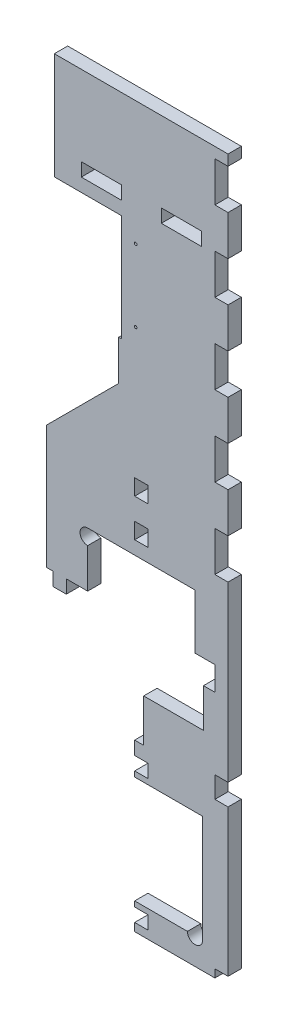
from build123d import *

# Parameters (mm, degrees)
BOSS_EXTRU_1_DEPTH      = 5
ESQUISSE2_R             = 2.8575
ESQUISSE2_R_2           = 0.5
ESQUISSE2_W             = 5
ESQUISSE2_H             = 6
ESQUISSE2_W_2           = 4.274370263
ESQUISSE2_H_2           = 8.980069935
ESQUISSE2_W_3           = 4.92
ESQUISSE2_H_3           = 3
ESQUISSE2_H_4           = 8
ESQUISSE2_H_5           = 15
ESQUISSE2_W_4           = 15
ESQUISSE2_H_6           = 5
ESQUISSE2_W_5           = 1
ESQUISSE2_H_7           = 40
ENL_V_MAT_EXTRU_1_DEPTH = 5
ESQUISSE3_W             = 5
ESQUISSE3_H             = 5
BOSS_EXTRU_2_DEPTH      = 5


with BuildPart() as part:
    # Esquisse1 → Boss.-Extru.1 (new body)
    with BuildSketch(Plane.XY):
        Polygon((65.121094869, 0), (30.122364869, 0), (30.122364869, 3), (35.122364869, 3), (35.122364869, 8), (30.122364869, 8), (30.122364869, 10), (55.617614869, 10), (55.617614869, 50.2), (30.122364869, 50.2), (30.122364869, 52.2), (35.122364869, 52.2), (35.122364869, 57.2), (30.122364869, 57.2), (30.122364869, 62.2), (33.512280837, 62.2), (33.512280837, 78.240708175), (55.911629737, 78.240708175), (55.911629737, 101.750434868), (52.693, 101.750434868), (52.693, 122.246954868), (12.493, 122.246954868), (12.493, 101.750434868), (-2.878905131, 101.750434868), (-2.878905131, 148), (24.121094869, 175), (24.121094869, 230), (0, 230), (0, 270), (65.121094869, 270), align=None)
    extrude(amount=-BOSS_EXTRU_1_DEPTH)

    # Esquisse2 → Enlèv. mat.-Extru.1 (cut)
    with BuildSketch(Plane.XY):
        with Locations((12.493, 119.389454868)):
            Circle(ESQUISSE2_R)
        with Locations((30.493, 223.5)):
            Circle(ESQUISSE2_R_2)
        with Locations((30.493, 196.5)):
            Circle(ESQUISSE2_R_2)
        with Locations((52.760114869, 10)):
            Circle(ESQUISSE2_R)
        with Locations((32.622364869, 144.401636706)):
            Rectangle(ESQUISSE2_W, ESQUISSE2_H)
        with Locations((32.622364869, 130.246954868)):
            Rectangle(ESQUISSE2_W, ESQUISSE2_H)
        with Locations((58.048814869, 97.260399901)):
            Rectangle(ESQUISSE2_W_2, ESQUISSE2_H_2)
        with Locations((62.661094869, 1.5)):
            Rectangle(ESQUISSE2_W_3, ESQUISSE2_H_3)
        with Locations((62.661094869, 62)):
            Rectangle(ESQUISSE2_W_3, ESQUISSE2_H_4)
        with Locations((62.661094869, 168.5)):
            Rectangle(ESQUISSE2_W_3, ESQUISSE2_H_5)
        with Locations((62.661094869, 138.5)):
            Rectangle(ESQUISSE2_W_3, ESQUISSE2_H_5)
        with Locations((62.661094869, 198.5)):
            Rectangle(ESQUISSE2_W_3, ESQUISSE2_H_5)
        with Locations((62.661094869, 228.5)):
            Rectangle(ESQUISSE2_W_3, ESQUISSE2_H_5)
        with Locations((62.661094869, 258.5)):
            Rectangle(ESQUISSE2_W_3, ESQUISSE2_H_5)
        with Locations((47.621094869, 237.5)):
            Rectangle(ESQUISSE2_W_4, ESQUISSE2_H_6)
        with Locations((17.621094869, 237.5)):
            Rectangle(ESQUISSE2_W_4, ESQUISSE2_H_6)
        with Locations((24.621094869, 210)):
            Rectangle(ESQUISSE2_W_5, ESQUISSE2_H_7)
    extrude(amount=-ENL_V_MAT_EXTRU_1_DEPTH, mode=Mode.SUBTRACT)

    # Esquisse3 → Boss.-Extru.2 (add)
    with BuildSketch(Plane.XY):
        with Locations((1.993, 99.250434868)):
            Rectangle(ESQUISSE3_W, ESQUISSE3_H)
    extrude(amount=-BOSS_EXTRU_2_DEPTH)


solid = part.part
